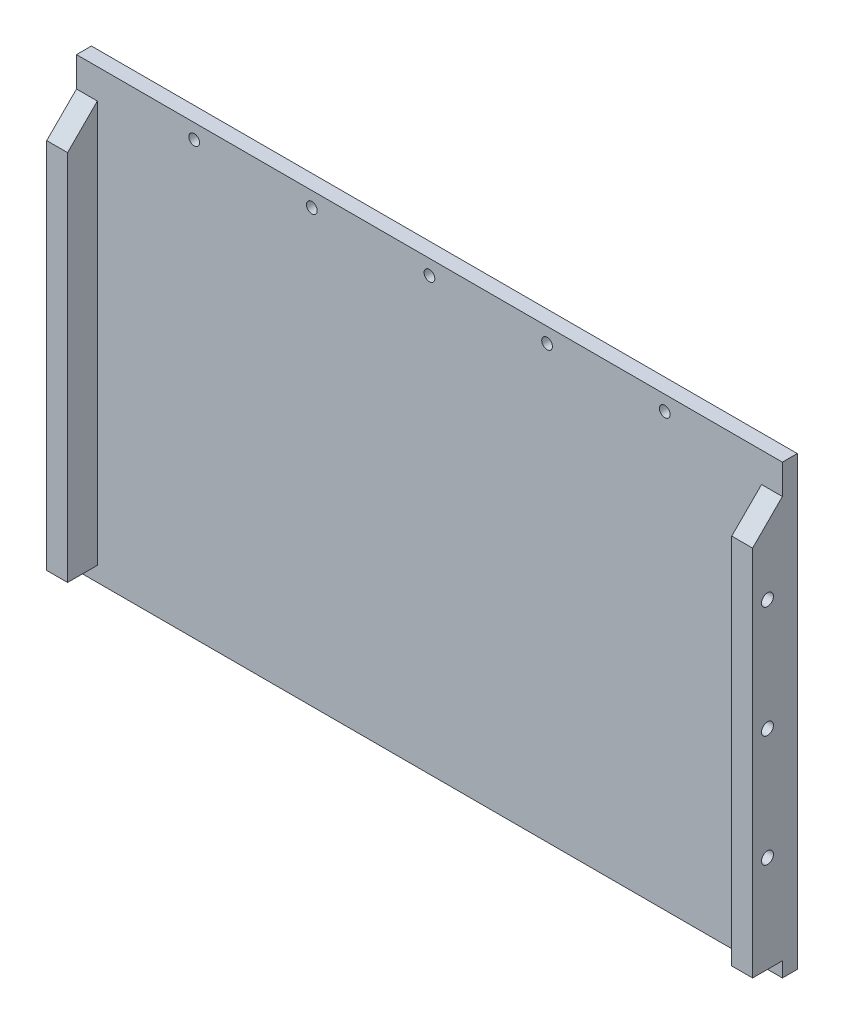
from build123d import *

# Parameters (mm, degrees)
SZKIC1_W                                          = 237
SZKIC1_H                                          = 150
DODANIE_WYCI_GNI_CIE1_DEPTH                       = 5
SZKIC2_W                                          = 7
SZKIC2_H                                          = 135
DODANIE_WYCI_GNI_CIE2_DEPTH                       = 10
OTW_R_4_0_4_1_D                                   = 4
OTW_R_4_0_4_1_DEPTH                               = 6.7
SFAZOWANIE1_SIZE                                  = 10
POG_BIENIE_WALCOWE_POD_M3_RUB_Z_BEM_S_D           = 3.6
POG_BIENIE_WALCOWE_POD_M3_RUB_Z_BEM_S_DEPTH       = 6.7
POG_BIENIE_WALCOWE_POD_M3_RUB_Z_BEM_S_CBORE_D     = 7
POG_BIENIE_WALCOWE_POD_M3_RUB_Z_BEM_S_CBORE_DEPTH = 2.4
POG_BIENIE_WALCOWE_POD_M3_RUB_Z_BEM_S_TIP         = 1.081549114
OTWORY_USTALAJ_CE_4_0MM1_D                        = 4
OTWORY_USTALAJ_CE_4_0MM1_DEPTH                    = 6.7


with BuildPart() as part:
    # Szkic1 → Dodanie-wyciągnięcie1 (new body)
    with BuildSketch(Plane.XY):
        Rectangle(SZKIC1_W, SZKIC1_H)
    extrude(amount=DODANIE_WYCI_GNI_CIE1_DEPTH)

    # Szkic2 → Dodanie-wyciągnięcie2 (add)
    with BuildSketch(Plane.XY.offset(5)):
        with Locations((115, -2.5)):
            Rectangle(SZKIC2_W, SZKIC2_H)
        with Locations((-115, -2.5)):
            Rectangle(SZKIC2_W, SZKIC2_H)
    extrude(amount=DODANIE_WYCI_GNI_CIE2_DEPTH)

    # Otwór Ø4.0 (4)1
    with Locations(Plane(origin=(118.5, 0, 0), x_dir=(0, 0, -1), z_dir=(1, 0, 0))):
        with Locations((-10, -37.5), (-10, 37.5), (-10, 0)):
            otw_r_4_0_4_1 = Hole(OTW_R_4_0_4_1_D / 2, depth=OTW_R_4_0_4_1_DEPTH)

    # Lustro1: Otwór Ø4.0 (4)1 across plane
    add(otw_r_4_0_4_1.mirror(Plane.ZY), mode=Mode.SUBTRACT)

    # Sfazowanie1
    sfazowanie1_edges = [part.edges().sort_by_distance(p)[0] for p in [
        (-115, 65, 15),
        (115, 65, 15),
    ]]
    chamfer(sfazowanie1_edges, length=SFAZOWANIE1_SIZE - 0.0001)  # a hair under: the kernel refuses the full size

    # Pogłębienie walcowe pod M3 Śrubę z łbem stożkowym ściętym1
    with Locations(Plane(origin=(0, 0, 0), x_dir=(-1, 0, 0), z_dir=(0, 0, -1))):
        with Locations((-79, 70), (-39.5, 70), (79, 70), (0, 70), (39.5, 70)):
            CounterBoreHole(POG_BIENIE_WALCOWE_POD_M3_RUB_Z_BEM_S_D / 2, POG_BIENIE_WALCOWE_POD_M3_RUB_Z_BEM_S_CBORE_D / 2, POG_BIENIE_WALCOWE_POD_M3_RUB_Z_BEM_S_CBORE_DEPTH, depth=POG_BIENIE_WALCOWE_POD_M3_RUB_Z_BEM_S_DEPTH)
            with Locations((0, 0, -(POG_BIENIE_WALCOWE_POD_M3_RUB_Z_BEM_S_DEPTH + POG_BIENIE_WALCOWE_POD_M3_RUB_Z_BEM_S_TIP / 2))):  # 118° drill point
                Cone(0, POG_BIENIE_WALCOWE_POD_M3_RUB_Z_BEM_S_D / 2, POG_BIENIE_WALCOWE_POD_M3_RUB_Z_BEM_S_TIP, mode=Mode.SUBTRACT)

    # Otwory ustalające Ø4.0mm1
    with Locations(Plane.XZ.offset(70)):
        with Locations((115, 10), (-115, 10)):
            Hole(OTWORY_USTALAJ_CE_4_0MM1_D / 2, depth=OTWORY_USTALAJ_CE_4_0MM1_DEPTH)


solid = part.part
